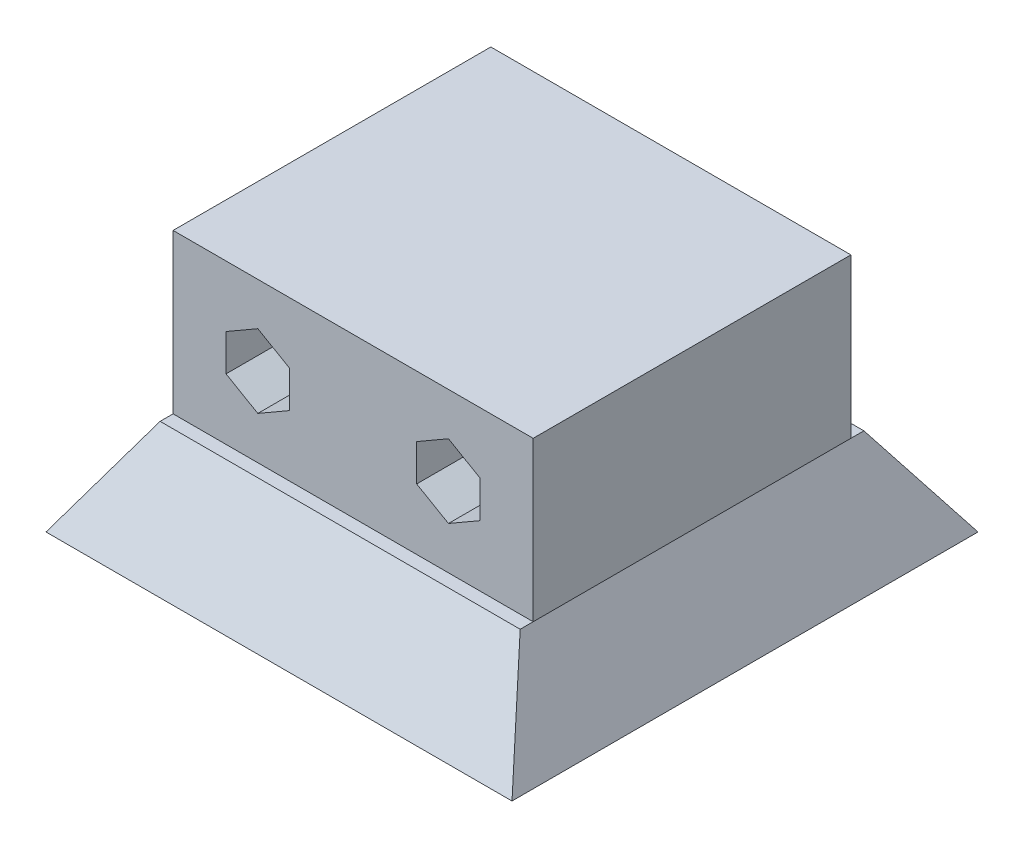
from build123d import *

# Parameters (mm, degrees)
SKETCH1_W                = 34
SKETCH1_H                = 15
BOSS_EXTRUDE1_DEPTH      = 30
BOSS_EXTRUDE2_DEPTH      = 7
BOSS_EXTRUDE2_DEPTH_BACK = 37
CUT_EXTRUDE1_DEPTH       = 65.601060663
CUT_EXTRUDE2_DEPTH       = 56.81218505


with BuildPart() as part:
    # Sketch1 → Boss-Extrude1 (new body)
    with BuildSketch(Plane.XY):
        with Locations((17, 7.5)):
            Rectangle(SKETCH1_W, SKETCH1_H)
    extrude(amount=BOSS_EXTRUDE1_DEPTH)

    # Sketch3 → Boss-Extrude2 (add, two sides: drawn at the far end of the back side and taken through both)
    with BuildSketch(Plane.XY.offset(30).offset(-BOSS_EXTRUDE2_DEPTH_BACK)):
        Polygon((0, 0), (-5, -8.660254038), (39, -8.660254038), (34, 0), align=None)
    extrude(amount=BOSS_EXTRUDE2_DEPTH + BOSS_EXTRUDE2_DEPTH_BACK)

    # Sketch4 → Cut-Extrude1 (cut, through all, along a direction that is not the sketch's normal)
    with BuildSketch(Plane(origin=(0, 0, 0), x_dir=(0, 0, 1), z_dir=(-0.8660254037844362, 0.5000000000000044, 0))):
        Polygon((-7, -10), (-1.226497308, 0), (-7, 0), align=None)
        Polygon((37, -10), (31.226497308, 0), (37, 0), align=None)
    extrude(amount=-CUT_EXTRUDE1_DEPTH, dir=(-1, 0, 0), mode=Mode.SUBTRACT)

    # Sketch5 → Cut-Extrude2 (cut, through all)
    with BuildSketch(Plane.XY.offset(30)):
        Polygon((8, 4.035898385), (11, 5.767949192), (11, 9.232050808), (8, 10.964101615), (5, 9.232050808), (5, 5.767949192), align=None)
        Polygon((26, 4.035898385), (29, 5.767949192), (29, 9.232050808), (26, 10.964101615), (23, 9.232050808), (23, 5.767949192), align=None)
    extrude(amount=-CUT_EXTRUDE2_DEPTH, mode=Mode.SUBTRACT)


solid = part.part
